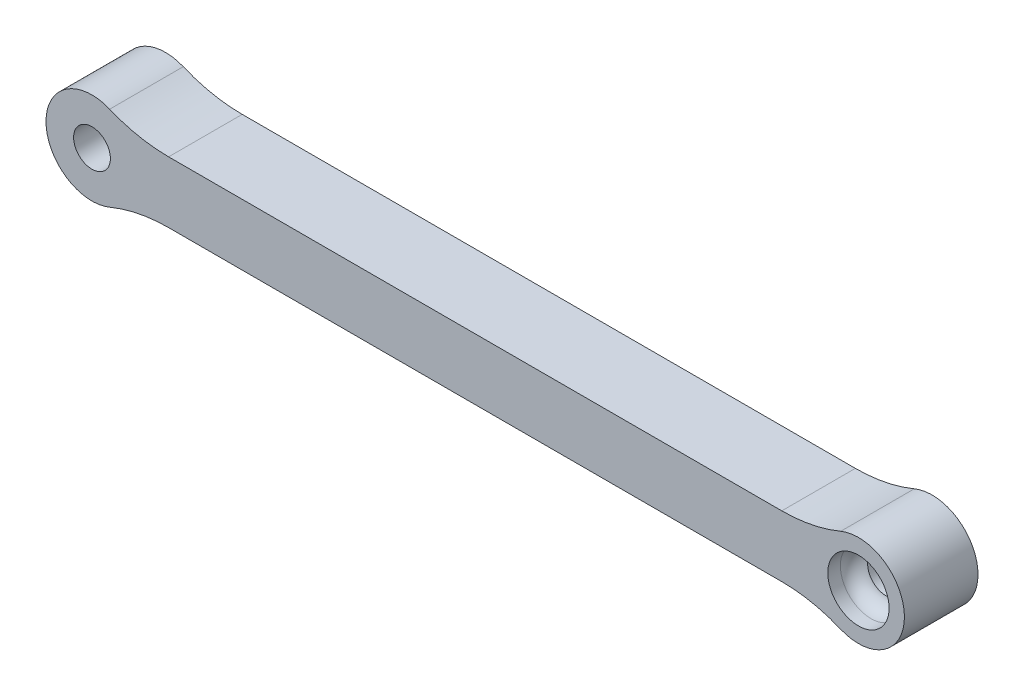
from build123d import *

# Parameters (mm, degrees)
SKETCH1_R           = 1.2
BOSS_EXTRUDE1_DEPTH = 4.8
SKETCH2_R           = 2
CUT_EXTRUDE1_DEPTH  = 1.8
FILLET1_R           = 1


with BuildPart() as part:
    # Sketch1 → Boss-Extrude1 (new body)
    with BuildSketch(Plane.XY):
        with BuildLine():
            Line((5, -2), (45, -2))
            ThreePointArc((45, -2), (46.961161351, -2.194193243), (48.846153846, -2.769230769))
            ThreePointArc((48.846153846, -2.769230769), (53, 0), (48.846153846, 2.769230769))
            ThreePointArc((48.846153846, 2.769230769), (46.961161351, 2.194193243), (45, 2))
            Line((45, 2), (5, 2))
            ThreePointArc((5, 2), (3.038838649, 2.194193243), (1.153846154, 2.769230769))
            ThreePointArc((1.153846154, 2.769230769), (-3, 0), (1.153846154, -2.769230769))
            ThreePointArc((1.153846154, -2.769230769), (3.038838649, -2.194193243), (5, -2))
        make_face()
        Circle(SKETCH1_R, mode=Mode.SUBTRACT)
        with Locations((50, 0)):
            Circle(SKETCH1_R, mode=Mode.SUBTRACT)
    extrude(amount=BOSS_EXTRUDE1_DEPTH)

    # Sketch2 → Cut-Extrude1 (cut)
    with BuildSketch(Plane.XY.offset(4.8)):
        with Locations((50, 0)):
            Circle(SKETCH2_R)
    extrude(amount=-CUT_EXTRUDE1_DEPTH, mode=Mode.SUBTRACT)

    # Fillet1
    # the kernel refuses this fillet: 1 mm, written as the material it adds along each edge
    with BuildSketch(Plane(origin=(50, 0, 3), x_dir=(1, 0, 0), z_dir=(0, -1, 0))) as fillet1_piece_1:
        with BuildLine():
            CenterArc((1, 0.979795897), FILLET1_R, 281.536959033, 78.463040967)
            Line((1.2, 0), (1.204, -0.019595918))
            ThreePointArc((1.204, -0.019595918), (1.6, -0.02), (2, -0.02))
            Line((2, -0.02), (2.02, 0))
            Line((2.02, 0), (2.02, 0.979795897))
            Line((2.02, 0.979795897), (2, 0.979795897))
        make_face()
    revolve(axis=Axis((50, 0, 3), (0, 0, 1)))


solid = part.part
